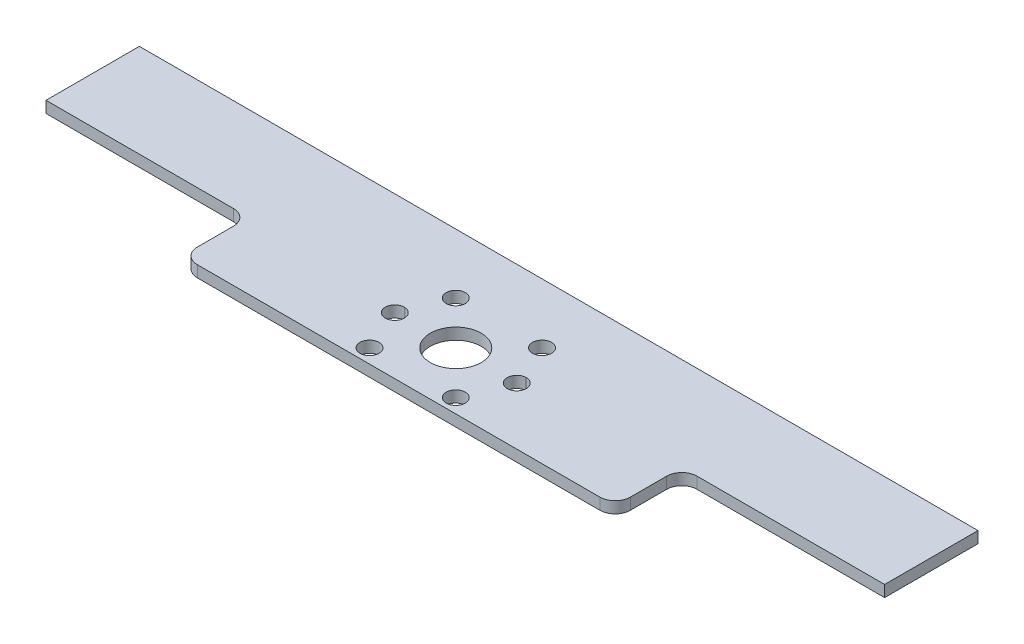
from build123d import *

# Parameters (mm, degrees)
SKETCH_2_R      = 2.5
SKETCH_2_R_2    = 6.682030953
EXTRUDE_1_DEPTH = 3
FILLET_1_R      = 4


with BuildPart() as part:
    # 草图2 → 凸台-拉伸1 (new body)
    with BuildSketch(Plane(origin=(0, 0, 0), x_dir=(1, 0, 0), z_dir=(0, 1, 0))):
        Polygon((56.805521657, -9.248304321), (110, -9.248304321), (110, 15.251695679), (-110, 15.251695679), (-110, -9.248304321), (-56.805521657, -9.248304321), (-56.805521657, -26.748304321), (56.805521657, -26.748304321), align=None)
        with BuildLine():
            Line((15.803480629, -9.248304321), (16, -9.248304321))
            ThreePointArc((16, -9.248304321), (16.097730955, -14.246393323), (15.8046875, -9.255945393))
            ThreePointArc((15.8046875, -9.255945393), (15.804084526, -9.252124784), (15.803480629, -9.248304321))
        make_face(mode=Mode.SUBTRACT)
        with Locations((11.313708499, -0.434595822)):
            Circle(SKETCH_2_R, mode=Mode.SUBTRACT)
        with Locations((11.313708499, -23.06201282)):
            Circle(SKETCH_2_R, mode=Mode.SUBTRACT)
        with Locations((0, -11.748304321)):
            Circle(SKETCH_2_R_2, mode=Mode.SUBTRACT)
        with Locations((-11.313708499, -0.434595822)):
            Circle(SKETCH_2_R, mode=Mode.SUBTRACT)
        with BuildLine():
            Line((-16.000000044, -9.248304321), (-15.803480629, -9.248304321))
            ThreePointArc((-15.803480629, -9.248304321), (-15.804084526, -9.252124784), (-15.8046875, -9.255945393))
            ThreePointArc((-15.8046875, -9.255945393), (-16.097730934, -14.246393324), (-16.000000044, -9.248304322))
        make_face(mode=Mode.SUBTRACT)
        with Locations((-11.313708499, -23.06201282)):
            Circle(SKETCH_2_R, mode=Mode.SUBTRACT)
    extrude(amount=EXTRUDE_1_DEPTH)

    # 圆角1
    fillet_1_edges = [part.edges().sort_by_distance(p)[0] for p in [
        (56.805521657, 1.5, 9.248304321),
        (56.805521657, 1.5, 26.748304321),
        (-56.805521657, 1.5, 9.248304321),
        (-56.805521657, 1.5, 26.748304321),
    ]]
    fillet(fillet_1_edges, radius=FILLET_1_R)


solid = part.part
